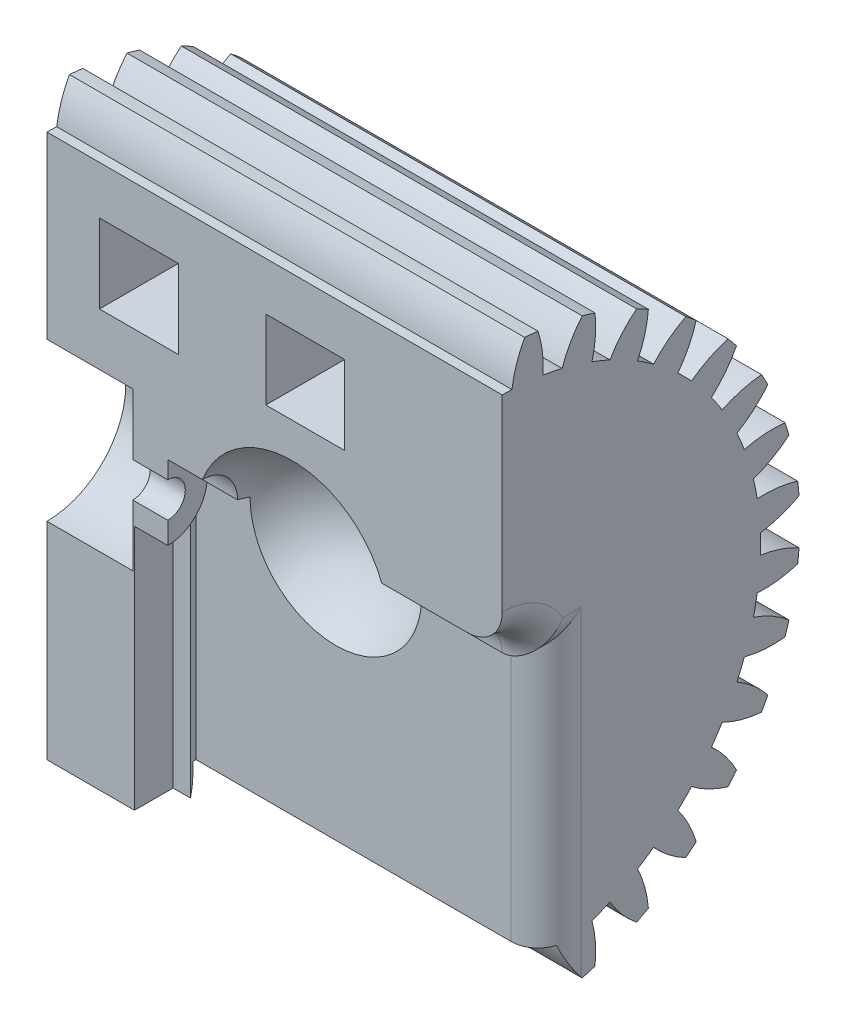
from build123d import *

# Parameters (mm, degrees)
BASPROSKE_W         = 10
BASPROSKE_H         = 8.5
TOOTHCUT_DEPTH      = 16.636495771
TEETHCUTS_COUNT     = 32
TEETHCUTS_ANGLE     = 348.75
BORSKE_R            = 1
BORE_DEPTH          = 50.0000508
SKETCH1_W           = 2.2
SKETCH1_H           = 12
CUT_EXTRUDE1_DEPTH  = 16.610070769
SKETCH4_R           = 1.125
SKETCH4_R_2         = 0.5
BOSS_EXTRUDE1_DEPTH = 0.5
BOSS_EXTRUDE2_REACH = 18.234
SKETCH5_W           = 2.5
SKETCH5_H           = 8.148803967
SKETCH6_R           = 2.25
CUT_EXTRUDE4_DEPTH  = 2.45
SKETCH7_R           = 0.5
CUT_EXTRUDE5_DEPTH  = 2.4
SKETCH8_W           = 11.062945953
SKETCH8_H           = 17.798852561
CUT_EXTRUDE7_DEPTH  = 10
SKETCH9_W           = 2.25
SKETCH9_H           = 2.25
CUT_EXTRUDE8_DEPTH  = 2.25
SKETCH10_W          = 1.25
SKETCH10_H          = 9
CUT_EXTRUDE10_DEPTH = 7
BOSS_EXTRUDE3_REACH = 18.961
BOSS_EXTRUDE4_DEPTH = 1.25
BOSS_EXTRUDE5_START = -1
BOSS_EXTRUDE5_DEPTH = 1
FILLET1_R           = 1


with BuildPart() as part:
    # BasProSke → Base-Revolve (revolve)
    with BuildSketch(Plane(origin=(0, 0, 0), x_dir=(1, 0, 0), z_dir=(0, 1, 0)), mode=Mode.PRIVATE) as base_revolve_sk:
        with Locations((5, 4.25)):
            Rectangle(BASPROSKE_W, BASPROSKE_H)
    revolve(base_revolve_sk.sketch.rotate(Axis((-10, 0, 0), (1, 0, 0)), 180), axis=Axis((-10, 0, 0), (1, 0, 0)))

    # TooCutSke → ToothCut (cut, through all)
    with BuildSketch(Plane(origin=(0, 0, 0), x_dir=(0, 0, -1), z_dir=(1, 0, 0))):
        with BuildLine():
            ThreePointArc((0.277002447, 7.3687954), (0, 7.374), (-0.277002447, 7.3687954))
            ThreePointArc((-0.277002447, 7.3687954), (-0.41335061, 7.952280695), (-0.656086882, 8.500117362))
            ThreePointArc((-0.656086882, 8.500117362), (0, 8.5254), (0.656086882, 8.500117362))
            ThreePointArc((0.656086882, 8.500117362), (0.41335061, 7.952280695), (0.277002447, 7.3687954))
        make_face()
    toothcut = extrude(amount=TOOTHCUT_DEPTH, mode=Mode.SUBTRACT)

    # TeethCuts: ToothCut ×32 about axis
    teethcuts_axis = Axis((-10, 0, 0), (1, 0, 0))
    for i in range(1, TEETHCUTS_COUNT):
        add(toothcut.rotate(teethcuts_axis, i * TEETHCUTS_ANGLE / (TEETHCUTS_COUNT - 1)), mode=Mode.SUBTRACT)

    # BorSke → Bore (cut, symmetric)
    with BuildSketch(Plane(origin=(0, 0, 0), x_dir=(0, 0, -1), z_dir=(1, 0, 0))):
        with Locations(Location((0, 0, 0), (0, 0, 180))):
            Circle(BORSKE_R)
    extrude(amount=BORE_DEPTH, both=True, mode=Mode.SUBTRACT)

    # Sketch1 → Cut-Extrude1 (cut, through all)
    with BuildSketch(Plane(origin=(10, 0, 0), x_dir=(0, 0, -1), z_dir=(1, 0, 0))):
        with Locations((0, -6)):
            Rectangle(SKETCH1_W, SKETCH1_H)
    extrude(amount=-CUT_EXTRUDE1_DEPTH, mode=Mode.SUBTRACT)

    # Sketch2 → Cut-Revolve1 (revolve, cut)
    with BuildSketch(Plane.XY):
        with BuildLine():
            Line((4.25, 0), (9.75, 0))
            ThreePointArc((9.75, 0), (7, 2.75), (4.25, 0))
        make_face()
    revolve(axis=Axis((4.25, 0, 0), (1, 0, 0)), mode=Mode.SUBTRACT)

    # Sketch4 → Boss-Extrude1 (add)
    with BuildSketch(Plane.ZY.offset(-3)):
        Circle(SKETCH4_R)
        Circle(SKETCH4_R_2, mode=Mode.SUBTRACT)
    extrude(amount=BOSS_EXTRUDE1_DEPTH)

    # Sketch5 → Boss-Extrude2 (add, up to next)
    with BuildSketch(Plane.XY.offset(-1.1), mode=Mode.PRIVATE) as boss_extrude2_sk1:
        with Locations((1.25, -4.074401984)):
            Rectangle(SKETCH5_W, SKETCH5_H)
    boss_extrude2_tool1 = extrude(boss_extrude2_sk1.sketch, amount=BOSS_EXTRUDE2_REACH, mode=Mode.PRIVATE) - part.part
    add(boss_extrude2_tool1.solids().sort_by_distance((1.25, -4.074402, -1.1))[0])

    # Sketch6 → Cut-Extrude4 (cut)
    with BuildSketch(Plane.ZY):
        Circle(SKETCH6_R)
    extrude(amount=-CUT_EXTRUDE4_DEPTH, mode=Mode.SUBTRACT)

    # Sketch7 → Cut-Extrude5 (cut)
    with BuildSketch(Plane(origin=(2.5, 0, 0), x_dir=(0, 0, -1), z_dir=(1, 0, 0))):
        with Locations(Location((0, 0, 0), (0, 0, 180))):
            Circle(SKETCH7_R)
    extrude(amount=-CUT_EXTRUDE5_DEPTH, mode=Mode.SUBTRACT)

    # Sketch8 → Cut-Extrude7 (cut)
    with BuildSketch(Plane.XY):
        with Locations((5.022304327, 0.010278679)):
            Rectangle(SKETCH8_W, SKETCH8_H)
    extrude(amount=CUT_EXTRUDE7_DEPTH, mode=Mode.SUBTRACT)

    # Sketch9 → Cut-Extrude8 (cut)
    with BuildSketch(Plane.XY):
        with Locations((2.625, 4.875)):
            Rectangle(SKETCH9_W, SKETCH9_H)
        with Locations((7.375, 4.875)):
            Rectangle(SKETCH9_W, SKETCH9_H)
    extrude(amount=-CUT_EXTRUDE8_DEPTH, mode=Mode.SUBTRACT)

    # Sketch10 → Cut-Extrude10 (cut)
    with BuildSketch(Plane(origin=(10, 0, 0), x_dir=(0, 0, -1), z_dir=(1, 0, 0))):
        with Locations((0.625, -4.5)):
            Rectangle(SKETCH10_W, SKETCH10_H)
    extrude(amount=-CUT_EXTRUDE10_DEPTH, mode=Mode.SUBTRACT)

    # Sketch11 → Boss-Extrude3 (add, up to next)
    with BuildSketch(Plane(origin=(12, 0, 0), x_dir=(0, 0, -1), z_dir=(1, 0, 0)), mode=Mode.PRIVATE) as boss_extrude3_sk1:
        with BuildLine():
            Line((0, 1), (0, 7.374))
            ThreePointArc((0, 7.374), (0.138525669, 7.372698735), (0.277002447, 7.3687954))
            ThreePointArc((0.277002447, 7.3687954), (0.408940123, 7.939022225), (0.642530382, 8.475680191))
            ThreePointArc((0.642530382, 8.475680191), (0.833145693, 8.459070177), (1.023338837, 8.438173832))
            ThreePointArc((1.023338837, 8.438173832), (1.14774395, 7.866256399), (1.165900745, 7.281246559))
            ThreePointArc((1.165900745, 7.281246559), (1.438596035, 7.232310658), (1.70926059, 7.173165566))
            ThreePointArc((1.70926059, 7.173165566), (1.949908855, 7.706695879), (2.283707519, 8.187470914))
            ThreePointArc((2.283707519, 8.187470914), (2.467419757, 8.133992854), (2.649881718, 8.076393185))
            ThreePointArc((2.649881718, 8.076393185), (2.660320865, 7.491194752), (2.563999025, 6.913883496))
            ThreePointArc((2.563999025, 6.913883496), (2.82190763, 6.812687673), (3.075832807, 6.701875002))
            ThreePointArc((3.075832807, 6.701875002), (3.415943684, 7.178205532), (3.837123056, 7.584621721))
            ThreePointArc((3.837123056, 7.584621721), (4.006872263, 7.496330747), (4.174591131, 7.404241277))
            ThreePointArc((4.174591131, 7.404241277), (4.070663142, 6.828250691), (3.86356426, 6.280823768))
            ThreePointArc((3.86356426, 6.280823768), (4.096774898, 6.131256921), (4.324202495, 5.97303514))
            ThreePointArc((4.324202495, 5.97303514), (4.750705713, 6.373860772), (5.243080107, 6.690299769))
            ThreePointArc((5.243080107, 6.690299769), (5.392342915, 6.570588854), (5.538873348, 6.447548529))
            ThreePointArc((5.538873348, 6.447548529), (5.324572118, 5.902900785), (5.014654888, 5.406395505))
            ThreePointArc((5.014654888, 5.406395505), (5.214205404, 5.214205404), (5.406395505, 5.014654888))
            ThreePointArc((5.406395505, 5.014654888), (5.902900785, 5.324572118), (6.447548529, 5.538873348))
            ThreePointArc((6.447548529, 5.538873348), (6.570588854, 5.392342915), (6.690299769, 5.243080107))
            ThreePointArc((6.690299769, 5.243080107), (6.373860772, 4.750705713), (5.97303514, 4.324202495))
            ThreePointArc((5.97303514, 4.324202495), (6.131256921, 4.096774898), (6.280823768, 3.86356426))
            ThreePointArc((6.280823768, 3.86356426), (6.828250691, 4.070663142), (7.404241277, 4.174591131))
            ThreePointArc((7.404241277, 4.174591131), (7.496330747, 4.006872263), (7.584621721, 3.837123056))
            ThreePointArc((7.584621721, 3.837123056), (7.178205532, 3.415943684), (6.701875002, 3.075832807))
            ThreePointArc((6.701875002, 3.075832807), (6.812687673, 2.82190763), (6.913883496, 2.563999025))
            ThreePointArc((6.913883496, 2.563999025), (7.491194752, 2.660320865), (8.076393185, 2.649881718))
            ThreePointArc((8.076393185, 2.649881718), (8.133992854, 2.467419757), (8.187470914, 2.283707519))
            ThreePointArc((8.187470914, 2.283707519), (7.706695879, 1.949908855), (7.173165566, 1.70926059))
            ThreePointArc((7.173165566, 1.70926059), (7.232310658, 1.438596035), (7.281246559, 1.165900745))
            ThreePointArc((7.281246559, 1.165900745), (7.866256399, 1.14774395), (8.438173832, 1.023338837))
            ThreePointArc((8.438173832, 1.023338837), (8.459070177, 0.833145693), (8.475680191, 0.642530382))
            ThreePointArc((8.475680191, 0.642530382), (7.939022225, 0.408940123), (7.3687954, 0.277002447))
            ThreePointArc((7.3687954, 0.277002447), (7.374, 0), (7.3687954, -0.277002447))
            ThreePointArc((7.3687954, -0.277002447), (7.939022225, -0.408940123), (8.475680191, -0.642530382))
            ThreePointArc((8.475680191, -0.642530382), (8.459070177, -0.833145693), (8.438173832, -1.023338837))
            ThreePointArc((8.438173832, -1.023338837), (7.866256399, -1.14774395), (7.281246559, -1.165900745))
            ThreePointArc((7.281246559, -1.165900745), (7.232310658, -1.438596035), (7.173165566, -1.70926059))
            ThreePointArc((7.173165566, -1.70926059), (7.706695879, -1.949908855), (8.187470914, -2.283707519))
            ThreePointArc((8.187470914, -2.283707519), (8.133992854, -2.467419757), (8.076393185, -2.649881718))
            ThreePointArc((8.076393185, -2.649881718), (7.491194752, -2.660320865), (6.913883496, -2.563999025))
            ThreePointArc((6.913883496, -2.563999025), (6.812687673, -2.82190763), (6.701875002, -3.075832807))
            ThreePointArc((6.701875002, -3.075832807), (7.178205532, -3.415943684), (7.584621721, -3.837123056))
            ThreePointArc((7.584621721, -3.837123056), (7.496330747, -4.006872263), (7.404241277, -4.174591131))
            ThreePointArc((7.404241277, -4.174591131), (6.828250691, -4.070663142), (6.280823768, -3.86356426))
            ThreePointArc((6.280823768, -3.86356426), (6.131256921, -4.096774898), (5.97303514, -4.324202495))
            ThreePointArc((5.97303514, -4.324202495), (6.373860772, -4.750705713), (6.690299769, -5.243080107))
            ThreePointArc((6.690299769, -5.243080107), (6.570588854, -5.392342915), (6.447548529, -5.538873348))
            ThreePointArc((6.447548529, -5.538873348), (5.902900785, -5.324572118), (5.406395505, -5.014654888))
            ThreePointArc((5.406395505, -5.014654888), (5.214205404, -5.214205404), (5.014654888, -5.406395505))
            ThreePointArc((5.014654888, -5.406395505), (5.324572118, -5.902900785), (5.538873348, -6.447548529))
            ThreePointArc((5.538873348, -6.447548529), (5.392342915, -6.570588854), (5.243080107, -6.690299769))
            ThreePointArc((5.243080107, -6.690299769), (4.750705713, -6.373860772), (4.324202495, -5.97303514))
            ThreePointArc((4.324202495, -5.97303514), (4.096774898, -6.131256921), (3.86356426, -6.280823768))
            ThreePointArc((3.86356426, -6.280823768), (4.070663142, -6.828250691), (4.174591131, -7.404241277))
            ThreePointArc((4.174591131, -7.404241277), (4.006872263, -7.496330747), (3.837123056, -7.584621721))
            ThreePointArc((3.837123056, -7.584621721), (3.415943684, -7.178205532), (3.075832807, -6.701875002))
            ThreePointArc((3.075832807, -6.701875002), (2.82190763, -6.812687673), (2.563999025, -6.913883496))
            ThreePointArc((2.563999025, -6.913883496), (2.660320865, -7.491194752), (2.649881718, -8.076393185))
            ThreePointArc((2.649881718, -8.076393185), (2.467419757, -8.133992854), (2.283707519, -8.187470914))
            ThreePointArc((2.283707519, -8.187470914), (1.949908855, -7.706695879), (1.70926059, -7.173165566))
            ThreePointArc((1.70926059, -7.173165566), (1.480378414, -7.223874013), (1.25, -7.267281197))
            Line((1.25, -7.267281197), (1.25, 0))
            Line((1.25, 0), (1, 0))
            ThreePointArc((1, 0), (0.707106781, 0.707106781), (0, 1))
        make_face()
    boss_extrude3_tool1 = extrude(boss_extrude3_sk1.sketch, amount=-BOSS_EXTRUDE3_REACH, mode=Mode.PRIVATE) - part.part
    add(boss_extrude3_tool1.solids().sort_by_distance((12, 0.4527, -3.714882))[0])

    # Sketch14 → Boss-Extrude4 (add)
    with BuildSketch(Plane(origin=(13, 0, 0), x_dir=(0, 0, -1), z_dir=(1, 0, 0))):
        with BuildLine():
            Line((0, 7.374), (0, 1))
            ThreePointArc((0, 1), (0.707106781, 0.707106781), (1, 0))
            Line((1, 0), (1.25, 0))
            Line((1.25, 0), (1.25, -7.267281197))
            ThreePointArc((1.25, -7.267281197), (1.480378414, -7.223874013), (1.70926059, -7.173165566))
            ThreePointArc((1.70926059, -7.173165566), (1.949908855, -7.706695879), (2.283707519, -8.187470914))
            ThreePointArc((2.283707519, -8.187470914), (2.467419757, -8.133992854), (2.649881718, -8.076393185))
            ThreePointArc((2.649881718, -8.076393185), (2.660320865, -7.491194752), (2.563999025, -6.913883496))
            ThreePointArc((2.563999025, -6.913883496), (2.82190763, -6.812687673), (3.075832807, -6.701875002))
            ThreePointArc((3.075832807, -6.701875002), (3.415943684, -7.178205532), (3.837123056, -7.584621721))
            ThreePointArc((3.837123056, -7.584621721), (4.006872263, -7.496330747), (4.174591131, -7.404241277))
            ThreePointArc((4.174591131, -7.404241277), (4.070663142, -6.828250691), (3.86356426, -6.280823768))
            ThreePointArc((3.86356426, -6.280823768), (4.096774898, -6.131256921), (4.324202495, -5.97303514))
            ThreePointArc((4.324202495, -5.97303514), (4.750705713, -6.373860772), (5.243080107, -6.690299769))
            ThreePointArc((5.243080107, -6.690299769), (5.392342915, -6.570588854), (5.538873348, -6.447548529))
            ThreePointArc((5.538873348, -6.447548529), (5.324572118, -5.902900785), (5.014654888, -5.406395505))
            ThreePointArc((5.014654888, -5.406395505), (5.214205404, -5.214205404), (5.406395505, -5.014654888))
            ThreePointArc((5.406395505, -5.014654888), (5.902900785, -5.324572118), (6.447548529, -5.538873348))
            ThreePointArc((6.447548529, -5.538873348), (6.570588854, -5.392342915), (6.690299769, -5.243080107))
            ThreePointArc((6.690299769, -5.243080107), (6.373860772, -4.750705713), (5.97303514, -4.324202495))
            ThreePointArc((5.97303514, -4.324202495), (6.131256921, -4.096774898), (6.280823768, -3.86356426))
            ThreePointArc((6.280823768, -3.86356426), (6.828250691, -4.070663142), (7.404241277, -4.174591131))
            ThreePointArc((7.404241277, -4.174591131), (7.496330747, -4.006872263), (7.584621721, -3.837123056))
            ThreePointArc((7.584621721, -3.837123056), (7.178205532, -3.415943684), (6.701875002, -3.075832807))
            ThreePointArc((6.701875002, -3.075832807), (6.812687673, -2.82190763), (6.913883496, -2.563999025))
            ThreePointArc((6.913883496, -2.563999025), (7.491194752, -2.660320865), (8.076393185, -2.649881718))
            ThreePointArc((8.076393185, -2.649881718), (8.133992854, -2.467419757), (8.187470914, -2.283707519))
            ThreePointArc((8.187470914, -2.283707519), (7.706695879, -1.949908855), (7.173165566, -1.70926059))
            ThreePointArc((7.173165566, -1.70926059), (7.232310658, -1.438596035), (7.281246559, -1.165900745))
            ThreePointArc((7.281246559, -1.165900745), (7.866256399, -1.14774395), (8.438173832, -1.023338837))
            ThreePointArc((8.438173832, -1.023338837), (8.459070177, -0.833145693), (8.475680191, -0.642530382))
            ThreePointArc((8.475680191, -0.642530382), (7.939022225, -0.408940123), (7.3687954, -0.277002447))
            ThreePointArc((7.3687954, -0.277002447), (7.374, 0), (7.3687954, 0.277002447))
            ThreePointArc((7.3687954, 0.277002447), (7.939022225, 0.408940123), (8.475680191, 0.642530382))
            ThreePointArc((8.475680191, 0.642530382), (8.459070177, 0.833145693), (8.438173832, 1.023338837))
            ThreePointArc((8.438173832, 1.023338837), (7.866256399, 1.14774395), (7.281246559, 1.165900745))
            ThreePointArc((7.281246559, 1.165900745), (7.232310658, 1.438596035), (7.173165566, 1.70926059))
            ThreePointArc((7.173165566, 1.70926059), (7.706695879, 1.949908855), (8.187470914, 2.283707519))
            ThreePointArc((8.187470914, 2.283707519), (8.133992854, 2.467419757), (8.076393185, 2.649881718))
            ThreePointArc((8.076393185, 2.649881718), (7.491194752, 2.660320865), (6.913883496, 2.563999025))
            ThreePointArc((6.913883496, 2.563999025), (6.812687673, 2.82190763), (6.701875002, 3.075832807))
            ThreePointArc((6.701875002, 3.075832807), (7.178205532, 3.415943684), (7.584621721, 3.837123056))
            ThreePointArc((7.584621721, 3.837123056), (7.496330747, 4.006872263), (7.404241277, 4.174591131))
            ThreePointArc((7.404241277, 4.174591131), (6.828250691, 4.070663142), (6.280823768, 3.86356426))
            ThreePointArc((6.280823768, 3.86356426), (6.131256921, 4.096774898), (5.97303514, 4.324202495))
            ThreePointArc((5.97303514, 4.324202495), (6.373860772, 4.750705713), (6.690299769, 5.243080107))
            ThreePointArc((6.690299769, 5.243080107), (6.570588854, 5.392342915), (6.447548529, 5.538873348))
            ThreePointArc((6.447548529, 5.538873348), (5.902900785, 5.324572118), (5.406395505, 5.014654888))
            ThreePointArc((5.406395505, 5.014654888), (5.214205404, 5.214205404), (5.014654888, 5.406395505))
            ThreePointArc((5.014654888, 5.406395505), (5.324572118, 5.902900785), (5.538873348, 6.447548529))
            ThreePointArc((5.538873348, 6.447548529), (5.392342915, 6.570588854), (5.243080107, 6.690299769))
            ThreePointArc((5.243080107, 6.690299769), (4.750705713, 6.373860772), (4.324202495, 5.97303514))
            ThreePointArc((4.324202495, 5.97303514), (4.096774898, 6.131256921), (3.86356426, 6.280823768))
            ThreePointArc((3.86356426, 6.280823768), (4.070663142, 6.828250691), (4.174591131, 7.404241277))
            ThreePointArc((4.174591131, 7.404241277), (4.006872263, 7.496330747), (3.837123056, 7.584621721))
            ThreePointArc((3.837123056, 7.584621721), (3.415943684, 7.178205532), (3.075832807, 6.701875002))
            ThreePointArc((3.075832807, 6.701875002), (2.82190763, 6.812687673), (2.563999025, 6.913883496))
            ThreePointArc((2.563999025, 6.913883496), (2.660320865, 7.491194752), (2.649881718, 8.076393185))
            ThreePointArc((2.649881718, 8.076393185), (2.467419757, 8.133992854), (2.283707519, 8.187470914))
            ThreePointArc((2.283707519, 8.187470914), (1.949908855, 7.706695879), (1.70926059, 7.173165566))
            ThreePointArc((1.70926059, 7.173165566), (1.438596035, 7.232310658), (1.165900745, 7.281246559))
            ThreePointArc((1.165900745, 7.281246559), (1.14774395, 7.866256399), (1.023338837, 8.438173832))
            ThreePointArc((1.023338837, 8.438173832), (0.833145693, 8.459070177), (0.642530382, 8.475680191))
            ThreePointArc((0.642530382, 8.475680191), (0.408940123, 7.939022225), (0.277002447, 7.3687954))
            ThreePointArc((0.277002447, 7.3687954), (0.138525669, 7.372698735), (0, 7.374))
        make_face()
    extrude(amount=-BOSS_EXTRUDE4_DEPTH)

    # Sketch15 → Boss-Extrude5 (add)
    with BuildSketch(Plane.ZY.offset(-2.45).offset(BOSS_EXTRUDE5_START)):
        with BuildLine():
            Line((0, 1.125), (0, 0.5))
            ThreePointArc((0, 0.5), (-0.5, 0), (0, -0.5))
            Line((0, -0.5), (0, -1.125))
            ThreePointArc((0, -1.125), (-1.125, 0), (0, 1.125))
        make_face()
    extrude(amount=BOSS_EXTRUDE5_DEPTH)

    # Fillet1
    fillet1_edges = [part.edges().sort_by_distance(p)[0] for p in [
        (13, 0, -1.125),
        (13, 0.707106781, -0.707106781),
        (13, -3.633640599, -1.25),
    ]]
    fillet(fillet1_edges, radius=FILLET1_R - 0.0001)  # a hair under: the kernel refuses the full size


solid = part.part
